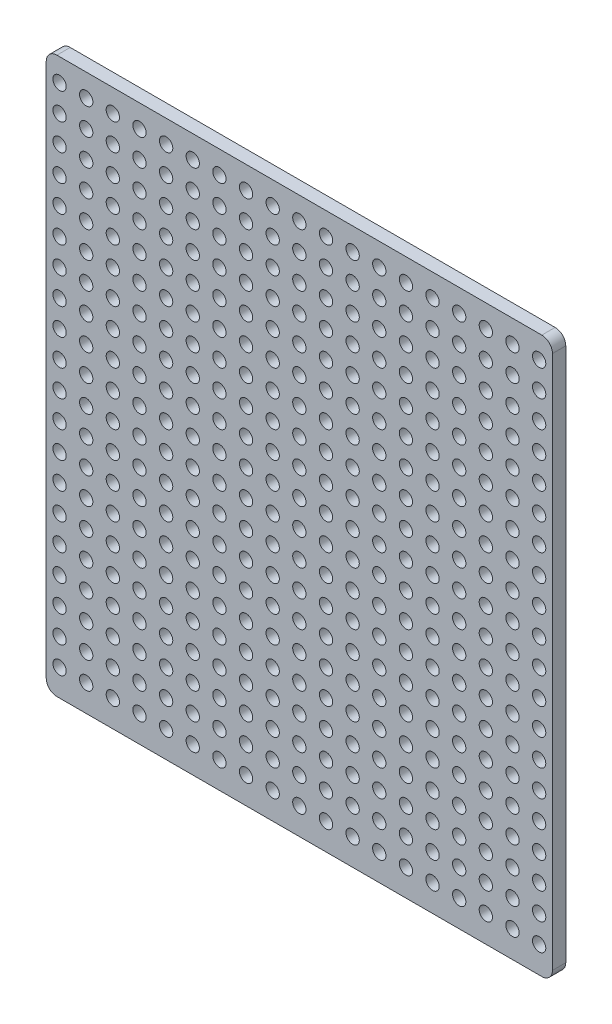
from build123d import *

# Parameters (mm, degrees)
SKETCH1_W           = 190
SKETCH1_H           = 208.5
SKETCH1_R           = 2.5
BOSS_EXTRUDE1_DEPTH = 5
FILLET1_R           = 4


with BuildPart() as part:
    # Sketch1 → Boss-Extrude1 (new body)
    with BuildSketch(Plane.XY):
        with Locations((95, 104.25)):
            Rectangle(SKETCH1_W, SKETCH1_H)
        with Locations((5, 10)):
            Circle(SKETCH1_R, mode=Mode.SUBTRACT)
        with Locations((15, 10)):
            Circle(SKETCH1_R, mode=Mode.SUBTRACT)
        with Locations((25, 10)):
            Circle(SKETCH1_R, mode=Mode.SUBTRACT)
        with Locations((35, 10)):
            Circle(SKETCH1_R, mode=Mode.SUBTRACT)
        with Locations((45, 10)):
            Circle(SKETCH1_R, mode=Mode.SUBTRACT)
        with Locations((55, 10)):
            Circle(SKETCH1_R, mode=Mode.SUBTRACT)
        with Locations((65, 10)):
            Circle(SKETCH1_R, mode=Mode.SUBTRACT)
        with Locations((75, 10)):
            Circle(SKETCH1_R, mode=Mode.SUBTRACT)
        with Locations((85, 10)):
            Circle(SKETCH1_R, mode=Mode.SUBTRACT)
        with Locations((95, 10)):
            Circle(SKETCH1_R, mode=Mode.SUBTRACT)
        with Locations((105, 10)):
            Circle(SKETCH1_R, mode=Mode.SUBTRACT)
        with Locations((115, 10)):
            Circle(SKETCH1_R, mode=Mode.SUBTRACT)
        with Locations((125, 10)):
            Circle(SKETCH1_R, mode=Mode.SUBTRACT)
        with Locations((135, 10)):
            Circle(SKETCH1_R, mode=Mode.SUBTRACT)
        with Locations((145, 10)):
            Circle(SKETCH1_R, mode=Mode.SUBTRACT)
        with Locations((155, 10)):
            Circle(SKETCH1_R, mode=Mode.SUBTRACT)
        with Locations((165, 10)):
            Circle(SKETCH1_R, mode=Mode.SUBTRACT)
        with Locations((175, 10)):
            Circle(SKETCH1_R, mode=Mode.SUBTRACT)
        with Locations((185, 10)):
            Circle(SKETCH1_R, mode=Mode.SUBTRACT)
        with Locations((15, 20)):
            Circle(SKETCH1_R, mode=Mode.SUBTRACT)
        with Locations((25, 20)):
            Circle(SKETCH1_R, mode=Mode.SUBTRACT)
        with Locations((35, 20)):
            Circle(SKETCH1_R, mode=Mode.SUBTRACT)
        with Locations((45, 20)):
            Circle(SKETCH1_R, mode=Mode.SUBTRACT)
        with Locations((55, 20)):
            Circle(SKETCH1_R, mode=Mode.SUBTRACT)
        with Locations((65, 20)):
            Circle(SKETCH1_R, mode=Mode.SUBTRACT)
        with Locations((75, 20)):
            Circle(SKETCH1_R, mode=Mode.SUBTRACT)
        with Locations((85, 20)):
            Circle(SKETCH1_R, mode=Mode.SUBTRACT)
        with Locations((95, 20)):
            Circle(SKETCH1_R, mode=Mode.SUBTRACT)
        with Locations((105, 20)):
            Circle(SKETCH1_R, mode=Mode.SUBTRACT)
        with Locations((115, 20)):
            Circle(SKETCH1_R, mode=Mode.SUBTRACT)
        with Locations((125, 20)):
            Circle(SKETCH1_R, mode=Mode.SUBTRACT)
        with Locations((135, 20)):
            Circle(SKETCH1_R, mode=Mode.SUBTRACT)
        with Locations((145, 20)):
            Circle(SKETCH1_R, mode=Mode.SUBTRACT)
        with Locations((155, 20)):
            Circle(SKETCH1_R, mode=Mode.SUBTRACT)
        with Locations((165, 20)):
            Circle(SKETCH1_R, mode=Mode.SUBTRACT)
        with Locations((175, 20)):
            Circle(SKETCH1_R, mode=Mode.SUBTRACT)
        with Locations((185, 20)):
            Circle(SKETCH1_R, mode=Mode.SUBTRACT)
        with Locations((15, 30)):
            Circle(SKETCH1_R, mode=Mode.SUBTRACT)
        with Locations((25, 30)):
            Circle(SKETCH1_R, mode=Mode.SUBTRACT)
        with Locations((35, 30)):
            Circle(SKETCH1_R, mode=Mode.SUBTRACT)
        with Locations((45, 30)):
            Circle(SKETCH1_R, mode=Mode.SUBTRACT)
        with Locations((55, 30)):
            Circle(SKETCH1_R, mode=Mode.SUBTRACT)
        with Locations((65, 30)):
            Circle(SKETCH1_R, mode=Mode.SUBTRACT)
        with Locations((75, 30)):
            Circle(SKETCH1_R, mode=Mode.SUBTRACT)
        with Locations((85, 30)):
            Circle(SKETCH1_R, mode=Mode.SUBTRACT)
        with Locations((95, 30)):
            Circle(SKETCH1_R, mode=Mode.SUBTRACT)
        with Locations((105, 30)):
            Circle(SKETCH1_R, mode=Mode.SUBTRACT)
        with Locations((115, 30)):
            Circle(SKETCH1_R, mode=Mode.SUBTRACT)
        with Locations((125, 30)):
            Circle(SKETCH1_R, mode=Mode.SUBTRACT)
        with Locations((135, 30)):
            Circle(SKETCH1_R, mode=Mode.SUBTRACT)
        with Locations((145, 30)):
            Circle(SKETCH1_R, mode=Mode.SUBTRACT)
        with Locations((155, 30)):
            Circle(SKETCH1_R, mode=Mode.SUBTRACT)
        with Locations((165, 30)):
            Circle(SKETCH1_R, mode=Mode.SUBTRACT)
        with Locations((175, 30)):
            Circle(SKETCH1_R, mode=Mode.SUBTRACT)
        with Locations((185, 30)):
            Circle(SKETCH1_R, mode=Mode.SUBTRACT)
        with Locations((15, 40)):
            Circle(SKETCH1_R, mode=Mode.SUBTRACT)
        with Locations((25, 40)):
            Circle(SKETCH1_R, mode=Mode.SUBTRACT)
        with Locations((35, 40)):
            Circle(SKETCH1_R, mode=Mode.SUBTRACT)
        with Locations((45, 40)):
            Circle(SKETCH1_R, mode=Mode.SUBTRACT)
        with Locations((55, 40)):
            Circle(SKETCH1_R, mode=Mode.SUBTRACT)
        with Locations((65, 40)):
            Circle(SKETCH1_R, mode=Mode.SUBTRACT)
        with Locations((75, 40)):
            Circle(SKETCH1_R, mode=Mode.SUBTRACT)
        with Locations((85, 40)):
            Circle(SKETCH1_R, mode=Mode.SUBTRACT)
        with Locations((95, 40)):
            Circle(SKETCH1_R, mode=Mode.SUBTRACT)
        with Locations((105, 40)):
            Circle(SKETCH1_R, mode=Mode.SUBTRACT)
        with Locations((115, 40)):
            Circle(SKETCH1_R, mode=Mode.SUBTRACT)
        with Locations((125, 40)):
            Circle(SKETCH1_R, mode=Mode.SUBTRACT)
        with Locations((135, 40)):
            Circle(SKETCH1_R, mode=Mode.SUBTRACT)
        with Locations((145, 40)):
            Circle(SKETCH1_R, mode=Mode.SUBTRACT)
        with Locations((155, 40)):
            Circle(SKETCH1_R, mode=Mode.SUBTRACT)
        with Locations((165, 40)):
            Circle(SKETCH1_R, mode=Mode.SUBTRACT)
        with Locations((175, 40)):
            Circle(SKETCH1_R, mode=Mode.SUBTRACT)
        with Locations((185, 40)):
            Circle(SKETCH1_R, mode=Mode.SUBTRACT)
        with Locations((15, 50)):
            Circle(SKETCH1_R, mode=Mode.SUBTRACT)
        with Locations((25, 50)):
            Circle(SKETCH1_R, mode=Mode.SUBTRACT)
        with Locations((35, 50)):
            Circle(SKETCH1_R, mode=Mode.SUBTRACT)
        with Locations((45, 50)):
            Circle(SKETCH1_R, mode=Mode.SUBTRACT)
        with Locations((55, 50)):
            Circle(SKETCH1_R, mode=Mode.SUBTRACT)
        with Locations((65, 50)):
            Circle(SKETCH1_R, mode=Mode.SUBTRACT)
        with Locations((75, 50)):
            Circle(SKETCH1_R, mode=Mode.SUBTRACT)
        with Locations((85, 50)):
            Circle(SKETCH1_R, mode=Mode.SUBTRACT)
        with Locations((95, 50)):
            Circle(SKETCH1_R, mode=Mode.SUBTRACT)
        with Locations((105, 50)):
            Circle(SKETCH1_R, mode=Mode.SUBTRACT)
        with Locations((115, 50)):
            Circle(SKETCH1_R, mode=Mode.SUBTRACT)
        with Locations((125, 50)):
            Circle(SKETCH1_R, mode=Mode.SUBTRACT)
        with Locations((135, 50)):
            Circle(SKETCH1_R, mode=Mode.SUBTRACT)
        with Locations((145, 50)):
            Circle(SKETCH1_R, mode=Mode.SUBTRACT)
        with Locations((155, 50)):
            Circle(SKETCH1_R, mode=Mode.SUBTRACT)
        with Locations((165, 50)):
            Circle(SKETCH1_R, mode=Mode.SUBTRACT)
        with Locations((175, 50)):
            Circle(SKETCH1_R, mode=Mode.SUBTRACT)
        with Locations((185, 50)):
            Circle(SKETCH1_R, mode=Mode.SUBTRACT)
        with Locations((15, 60)):
            Circle(SKETCH1_R, mode=Mode.SUBTRACT)
        with Locations((25, 60)):
            Circle(SKETCH1_R, mode=Mode.SUBTRACT)
        with Locations((35, 60)):
            Circle(SKETCH1_R, mode=Mode.SUBTRACT)
        with Locations((45, 60)):
            Circle(SKETCH1_R, mode=Mode.SUBTRACT)
        with Locations((55, 60)):
            Circle(SKETCH1_R, mode=Mode.SUBTRACT)
        with Locations((65, 60)):
            Circle(SKETCH1_R, mode=Mode.SUBTRACT)
        with Locations((75, 60)):
            Circle(SKETCH1_R, mode=Mode.SUBTRACT)
        with Locations((85, 60)):
            Circle(SKETCH1_R, mode=Mode.SUBTRACT)
        with Locations((95, 60)):
            Circle(SKETCH1_R, mode=Mode.SUBTRACT)
        with Locations((105, 60)):
            Circle(SKETCH1_R, mode=Mode.SUBTRACT)
        with Locations((115, 60)):
            Circle(SKETCH1_R, mode=Mode.SUBTRACT)
        with Locations((125, 60)):
            Circle(SKETCH1_R, mode=Mode.SUBTRACT)
        with Locations((135, 60)):
            Circle(SKETCH1_R, mode=Mode.SUBTRACT)
        with Locations((145, 60)):
            Circle(SKETCH1_R, mode=Mode.SUBTRACT)
        with Locations((155, 60)):
            Circle(SKETCH1_R, mode=Mode.SUBTRACT)
        with Locations((165, 60)):
            Circle(SKETCH1_R, mode=Mode.SUBTRACT)
        with Locations((175, 60)):
            Circle(SKETCH1_R, mode=Mode.SUBTRACT)
        with Locations((185, 60)):
            Circle(SKETCH1_R, mode=Mode.SUBTRACT)
        with Locations((15, 70)):
            Circle(SKETCH1_R, mode=Mode.SUBTRACT)
        with Locations((25, 70)):
            Circle(SKETCH1_R, mode=Mode.SUBTRACT)
        with Locations((35, 70)):
            Circle(SKETCH1_R, mode=Mode.SUBTRACT)
        with Locations((45, 70)):
            Circle(SKETCH1_R, mode=Mode.SUBTRACT)
        with Locations((55, 70)):
            Circle(SKETCH1_R, mode=Mode.SUBTRACT)
        with Locations((65, 70)):
            Circle(SKETCH1_R, mode=Mode.SUBTRACT)
        with Locations((75, 70)):
            Circle(SKETCH1_R, mode=Mode.SUBTRACT)
        with Locations((85, 70)):
            Circle(SKETCH1_R, mode=Mode.SUBTRACT)
        with Locations((95, 70)):
            Circle(SKETCH1_R, mode=Mode.SUBTRACT)
        with Locations((105, 70)):
            Circle(SKETCH1_R, mode=Mode.SUBTRACT)
        with Locations((115, 70)):
            Circle(SKETCH1_R, mode=Mode.SUBTRACT)
        with Locations((125, 70)):
            Circle(SKETCH1_R, mode=Mode.SUBTRACT)
        with Locations((135, 70)):
            Circle(SKETCH1_R, mode=Mode.SUBTRACT)
        with Locations((145, 70)):
            Circle(SKETCH1_R, mode=Mode.SUBTRACT)
        with Locations((155, 70)):
            Circle(SKETCH1_R, mode=Mode.SUBTRACT)
        with Locations((165, 70)):
            Circle(SKETCH1_R, mode=Mode.SUBTRACT)
        with Locations((175, 70)):
            Circle(SKETCH1_R, mode=Mode.SUBTRACT)
        with Locations((185, 70)):
            Circle(SKETCH1_R, mode=Mode.SUBTRACT)
        with Locations((15, 80)):
            Circle(SKETCH1_R, mode=Mode.SUBTRACT)
        with Locations((25, 80)):
            Circle(SKETCH1_R, mode=Mode.SUBTRACT)
        with Locations((35, 80)):
            Circle(SKETCH1_R, mode=Mode.SUBTRACT)
        with Locations((45, 80)):
            Circle(SKETCH1_R, mode=Mode.SUBTRACT)
        with Locations((55, 80)):
            Circle(SKETCH1_R, mode=Mode.SUBTRACT)
        with Locations((65, 80)):
            Circle(SKETCH1_R, mode=Mode.SUBTRACT)
        with Locations((75, 80)):
            Circle(SKETCH1_R, mode=Mode.SUBTRACT)
        with Locations((85, 80)):
            Circle(SKETCH1_R, mode=Mode.SUBTRACT)
        with Locations((95, 80)):
            Circle(SKETCH1_R, mode=Mode.SUBTRACT)
        with Locations((105, 80)):
            Circle(SKETCH1_R, mode=Mode.SUBTRACT)
        with Locations((115, 80)):
            Circle(SKETCH1_R, mode=Mode.SUBTRACT)
        with Locations((125, 80)):
            Circle(SKETCH1_R, mode=Mode.SUBTRACT)
        with Locations((135, 80)):
            Circle(SKETCH1_R, mode=Mode.SUBTRACT)
        with Locations((145, 80)):
            Circle(SKETCH1_R, mode=Mode.SUBTRACT)
        with Locations((155, 80)):
            Circle(SKETCH1_R, mode=Mode.SUBTRACT)
        with Locations((165, 80)):
            Circle(SKETCH1_R, mode=Mode.SUBTRACT)
        with Locations((175, 80)):
            Circle(SKETCH1_R, mode=Mode.SUBTRACT)
        with Locations((185, 80)):
            Circle(SKETCH1_R, mode=Mode.SUBTRACT)
        with Locations((15, 90)):
            Circle(SKETCH1_R, mode=Mode.SUBTRACT)
        with Locations((25, 90)):
            Circle(SKETCH1_R, mode=Mode.SUBTRACT)
        with Locations((35, 90)):
            Circle(SKETCH1_R, mode=Mode.SUBTRACT)
        with Locations((45, 90)):
            Circle(SKETCH1_R, mode=Mode.SUBTRACT)
        with Locations((55, 90)):
            Circle(SKETCH1_R, mode=Mode.SUBTRACT)
        with Locations((65, 90)):
            Circle(SKETCH1_R, mode=Mode.SUBTRACT)
        with Locations((75, 90)):
            Circle(SKETCH1_R, mode=Mode.SUBTRACT)
        with Locations((85, 90)):
            Circle(SKETCH1_R, mode=Mode.SUBTRACT)
        with Locations((95, 90)):
            Circle(SKETCH1_R, mode=Mode.SUBTRACT)
        with Locations((105, 90)):
            Circle(SKETCH1_R, mode=Mode.SUBTRACT)
        with Locations((115, 90)):
            Circle(SKETCH1_R, mode=Mode.SUBTRACT)
        with Locations((125, 90)):
            Circle(SKETCH1_R, mode=Mode.SUBTRACT)
        with Locations((135, 90)):
            Circle(SKETCH1_R, mode=Mode.SUBTRACT)
        with Locations((145, 90)):
            Circle(SKETCH1_R, mode=Mode.SUBTRACT)
        with Locations((155, 90)):
            Circle(SKETCH1_R, mode=Mode.SUBTRACT)
        with Locations((165, 90)):
            Circle(SKETCH1_R, mode=Mode.SUBTRACT)
        with Locations((175, 90)):
            Circle(SKETCH1_R, mode=Mode.SUBTRACT)
        with Locations((185, 90)):
            Circle(SKETCH1_R, mode=Mode.SUBTRACT)
        with Locations((15, 100)):
            Circle(SKETCH1_R, mode=Mode.SUBTRACT)
        with Locations((25, 100)):
            Circle(SKETCH1_R, mode=Mode.SUBTRACT)
        with Locations((35, 100)):
            Circle(SKETCH1_R, mode=Mode.SUBTRACT)
        with Locations((45, 100)):
            Circle(SKETCH1_R, mode=Mode.SUBTRACT)
        with Locations((55, 100)):
            Circle(SKETCH1_R, mode=Mode.SUBTRACT)
        with Locations((65, 100)):
            Circle(SKETCH1_R, mode=Mode.SUBTRACT)
        with Locations((75, 100)):
            Circle(SKETCH1_R, mode=Mode.SUBTRACT)
        with Locations((85, 100)):
            Circle(SKETCH1_R, mode=Mode.SUBTRACT)
        with Locations((95, 100)):
            Circle(SKETCH1_R, mode=Mode.SUBTRACT)
        with Locations((105, 100)):
            Circle(SKETCH1_R, mode=Mode.SUBTRACT)
        with Locations((115, 100)):
            Circle(SKETCH1_R, mode=Mode.SUBTRACT)
        with Locations((125, 100)):
            Circle(SKETCH1_R, mode=Mode.SUBTRACT)
        with Locations((135, 100)):
            Circle(SKETCH1_R, mode=Mode.SUBTRACT)
        with Locations((145, 100)):
            Circle(SKETCH1_R, mode=Mode.SUBTRACT)
        with Locations((155, 100)):
            Circle(SKETCH1_R, mode=Mode.SUBTRACT)
        with Locations((165, 100)):
            Circle(SKETCH1_R, mode=Mode.SUBTRACT)
        with Locations((175, 100)):
            Circle(SKETCH1_R, mode=Mode.SUBTRACT)
        with Locations((185, 100)):
            Circle(SKETCH1_R, mode=Mode.SUBTRACT)
        with Locations((15, 110)):
            Circle(SKETCH1_R, mode=Mode.SUBTRACT)
        with Locations((25, 110)):
            Circle(SKETCH1_R, mode=Mode.SUBTRACT)
        with Locations((35, 110)):
            Circle(SKETCH1_R, mode=Mode.SUBTRACT)
        with Locations((45, 110)):
            Circle(SKETCH1_R, mode=Mode.SUBTRACT)
        with Locations((55, 110)):
            Circle(SKETCH1_R, mode=Mode.SUBTRACT)
        with Locations((65, 110)):
            Circle(SKETCH1_R, mode=Mode.SUBTRACT)
        with Locations((75, 110)):
            Circle(SKETCH1_R, mode=Mode.SUBTRACT)
        with Locations((85, 110)):
            Circle(SKETCH1_R, mode=Mode.SUBTRACT)
        with Locations((95, 110)):
            Circle(SKETCH1_R, mode=Mode.SUBTRACT)
        with Locations((105, 110)):
            Circle(SKETCH1_R, mode=Mode.SUBTRACT)
        with Locations((115, 110)):
            Circle(SKETCH1_R, mode=Mode.SUBTRACT)
        with Locations((125, 110)):
            Circle(SKETCH1_R, mode=Mode.SUBTRACT)
        with Locations((135, 110)):
            Circle(SKETCH1_R, mode=Mode.SUBTRACT)
        with Locations((145, 110)):
            Circle(SKETCH1_R, mode=Mode.SUBTRACT)
        with Locations((155, 110)):
            Circle(SKETCH1_R, mode=Mode.SUBTRACT)
        with Locations((165, 110)):
            Circle(SKETCH1_R, mode=Mode.SUBTRACT)
        with Locations((175, 110)):
            Circle(SKETCH1_R, mode=Mode.SUBTRACT)
        with Locations((185, 110)):
            Circle(SKETCH1_R, mode=Mode.SUBTRACT)
        with Locations((15, 120)):
            Circle(SKETCH1_R, mode=Mode.SUBTRACT)
        with Locations((25, 120)):
            Circle(SKETCH1_R, mode=Mode.SUBTRACT)
        with Locations((35, 120)):
            Circle(SKETCH1_R, mode=Mode.SUBTRACT)
        with Locations((45, 120)):
            Circle(SKETCH1_R, mode=Mode.SUBTRACT)
        with Locations((55, 120)):
            Circle(SKETCH1_R, mode=Mode.SUBTRACT)
        with Locations((65, 120)):
            Circle(SKETCH1_R, mode=Mode.SUBTRACT)
        with Locations((75, 120)):
            Circle(SKETCH1_R, mode=Mode.SUBTRACT)
        with Locations((85, 120)):
            Circle(SKETCH1_R, mode=Mode.SUBTRACT)
        with Locations((95, 120)):
            Circle(SKETCH1_R, mode=Mode.SUBTRACT)
        with Locations((105, 120)):
            Circle(SKETCH1_R, mode=Mode.SUBTRACT)
        with Locations((115, 120)):
            Circle(SKETCH1_R, mode=Mode.SUBTRACT)
        with Locations((125, 120)):
            Circle(SKETCH1_R, mode=Mode.SUBTRACT)
        with Locations((135, 120)):
            Circle(SKETCH1_R, mode=Mode.SUBTRACT)
        with Locations((145, 120)):
            Circle(SKETCH1_R, mode=Mode.SUBTRACT)
        with Locations((155, 120)):
            Circle(SKETCH1_R, mode=Mode.SUBTRACT)
        with Locations((165, 120)):
            Circle(SKETCH1_R, mode=Mode.SUBTRACT)
        with Locations((175, 120)):
            Circle(SKETCH1_R, mode=Mode.SUBTRACT)
        with Locations((185, 120)):
            Circle(SKETCH1_R, mode=Mode.SUBTRACT)
        with Locations((15, 130)):
            Circle(SKETCH1_R, mode=Mode.SUBTRACT)
        with Locations((25, 130)):
            Circle(SKETCH1_R, mode=Mode.SUBTRACT)
        with Locations((35, 130)):
            Circle(SKETCH1_R, mode=Mode.SUBTRACT)
        with Locations((45, 130)):
            Circle(SKETCH1_R, mode=Mode.SUBTRACT)
        with Locations((55, 130)):
            Circle(SKETCH1_R, mode=Mode.SUBTRACT)
        with Locations((65, 130)):
            Circle(SKETCH1_R, mode=Mode.SUBTRACT)
        with Locations((75, 130)):
            Circle(SKETCH1_R, mode=Mode.SUBTRACT)
        with Locations((85, 130)):
            Circle(SKETCH1_R, mode=Mode.SUBTRACT)
        with Locations((95, 130)):
            Circle(SKETCH1_R, mode=Mode.SUBTRACT)
        with Locations((105, 130)):
            Circle(SKETCH1_R, mode=Mode.SUBTRACT)
        with Locations((115, 130)):
            Circle(SKETCH1_R, mode=Mode.SUBTRACT)
        with Locations((125, 130)):
            Circle(SKETCH1_R, mode=Mode.SUBTRACT)
        with Locations((135, 130)):
            Circle(SKETCH1_R, mode=Mode.SUBTRACT)
        with Locations((145, 130)):
            Circle(SKETCH1_R, mode=Mode.SUBTRACT)
        with Locations((155, 130)):
            Circle(SKETCH1_R, mode=Mode.SUBTRACT)
        with Locations((165, 130)):
            Circle(SKETCH1_R, mode=Mode.SUBTRACT)
        with Locations((175, 130)):
            Circle(SKETCH1_R, mode=Mode.SUBTRACT)
        with Locations((185, 130)):
            Circle(SKETCH1_R, mode=Mode.SUBTRACT)
        with Locations((15, 140)):
            Circle(SKETCH1_R, mode=Mode.SUBTRACT)
        with Locations((25, 140)):
            Circle(SKETCH1_R, mode=Mode.SUBTRACT)
        with Locations((35, 140)):
            Circle(SKETCH1_R, mode=Mode.SUBTRACT)
        with Locations((45, 140)):
            Circle(SKETCH1_R, mode=Mode.SUBTRACT)
        with Locations((55, 140)):
            Circle(SKETCH1_R, mode=Mode.SUBTRACT)
        with Locations((65, 140)):
            Circle(SKETCH1_R, mode=Mode.SUBTRACT)
        with Locations((75, 140)):
            Circle(SKETCH1_R, mode=Mode.SUBTRACT)
        with Locations((85, 140)):
            Circle(SKETCH1_R, mode=Mode.SUBTRACT)
        with Locations((95, 140)):
            Circle(SKETCH1_R, mode=Mode.SUBTRACT)
        with Locations((105, 140)):
            Circle(SKETCH1_R, mode=Mode.SUBTRACT)
        with Locations((115, 140)):
            Circle(SKETCH1_R, mode=Mode.SUBTRACT)
        with Locations((125, 140)):
            Circle(SKETCH1_R, mode=Mode.SUBTRACT)
        with Locations((135, 140)):
            Circle(SKETCH1_R, mode=Mode.SUBTRACT)
        with Locations((145, 140)):
            Circle(SKETCH1_R, mode=Mode.SUBTRACT)
        with Locations((155, 140)):
            Circle(SKETCH1_R, mode=Mode.SUBTRACT)
        with Locations((165, 140)):
            Circle(SKETCH1_R, mode=Mode.SUBTRACT)
        with Locations((175, 140)):
            Circle(SKETCH1_R, mode=Mode.SUBTRACT)
        with Locations((185, 140)):
            Circle(SKETCH1_R, mode=Mode.SUBTRACT)
        with Locations((15, 150)):
            Circle(SKETCH1_R, mode=Mode.SUBTRACT)
        with Locations((25, 150)):
            Circle(SKETCH1_R, mode=Mode.SUBTRACT)
        with Locations((35, 150)):
            Circle(SKETCH1_R, mode=Mode.SUBTRACT)
        with Locations((45, 150)):
            Circle(SKETCH1_R, mode=Mode.SUBTRACT)
        with Locations((55, 150)):
            Circle(SKETCH1_R, mode=Mode.SUBTRACT)
        with Locations((65, 150)):
            Circle(SKETCH1_R, mode=Mode.SUBTRACT)
        with Locations((75, 150)):
            Circle(SKETCH1_R, mode=Mode.SUBTRACT)
        with Locations((85, 150)):
            Circle(SKETCH1_R, mode=Mode.SUBTRACT)
        with Locations((95, 150)):
            Circle(SKETCH1_R, mode=Mode.SUBTRACT)
        with Locations((105, 150)):
            Circle(SKETCH1_R, mode=Mode.SUBTRACT)
        with Locations((115, 150)):
            Circle(SKETCH1_R, mode=Mode.SUBTRACT)
        with Locations((125, 150)):
            Circle(SKETCH1_R, mode=Mode.SUBTRACT)
        with Locations((135, 150)):
            Circle(SKETCH1_R, mode=Mode.SUBTRACT)
        with Locations((145, 150)):
            Circle(SKETCH1_R, mode=Mode.SUBTRACT)
        with Locations((155, 150)):
            Circle(SKETCH1_R, mode=Mode.SUBTRACT)
        with Locations((165, 150)):
            Circle(SKETCH1_R, mode=Mode.SUBTRACT)
        with Locations((175, 150)):
            Circle(SKETCH1_R, mode=Mode.SUBTRACT)
        with Locations((185, 150)):
            Circle(SKETCH1_R, mode=Mode.SUBTRACT)
        with Locations((15, 160)):
            Circle(SKETCH1_R, mode=Mode.SUBTRACT)
        with Locations((25, 160)):
            Circle(SKETCH1_R, mode=Mode.SUBTRACT)
        with Locations((35, 160)):
            Circle(SKETCH1_R, mode=Mode.SUBTRACT)
        with Locations((45, 160)):
            Circle(SKETCH1_R, mode=Mode.SUBTRACT)
        with Locations((55, 160)):
            Circle(SKETCH1_R, mode=Mode.SUBTRACT)
        with Locations((65, 160)):
            Circle(SKETCH1_R, mode=Mode.SUBTRACT)
        with Locations((75, 160)):
            Circle(SKETCH1_R, mode=Mode.SUBTRACT)
        with Locations((85, 160)):
            Circle(SKETCH1_R, mode=Mode.SUBTRACT)
        with Locations((95, 160)):
            Circle(SKETCH1_R, mode=Mode.SUBTRACT)
        with Locations((105, 160)):
            Circle(SKETCH1_R, mode=Mode.SUBTRACT)
        with Locations((115, 160)):
            Circle(SKETCH1_R, mode=Mode.SUBTRACT)
        with Locations((125, 160)):
            Circle(SKETCH1_R, mode=Mode.SUBTRACT)
        with Locations((135, 160)):
            Circle(SKETCH1_R, mode=Mode.SUBTRACT)
        with Locations((145, 160)):
            Circle(SKETCH1_R, mode=Mode.SUBTRACT)
        with Locations((155, 160)):
            Circle(SKETCH1_R, mode=Mode.SUBTRACT)
        with Locations((165, 160)):
            Circle(SKETCH1_R, mode=Mode.SUBTRACT)
        with Locations((175, 160)):
            Circle(SKETCH1_R, mode=Mode.SUBTRACT)
        with Locations((185, 160)):
            Circle(SKETCH1_R, mode=Mode.SUBTRACT)
        with Locations((15, 170)):
            Circle(SKETCH1_R, mode=Mode.SUBTRACT)
        with Locations((25, 170)):
            Circle(SKETCH1_R, mode=Mode.SUBTRACT)
        with Locations((35, 170)):
            Circle(SKETCH1_R, mode=Mode.SUBTRACT)
        with Locations((45, 170)):
            Circle(SKETCH1_R, mode=Mode.SUBTRACT)
        with Locations((55, 170)):
            Circle(SKETCH1_R, mode=Mode.SUBTRACT)
        with Locations((65, 170)):
            Circle(SKETCH1_R, mode=Mode.SUBTRACT)
        with Locations((75, 170)):
            Circle(SKETCH1_R, mode=Mode.SUBTRACT)
        with Locations((85, 170)):
            Circle(SKETCH1_R, mode=Mode.SUBTRACT)
        with Locations((95, 170)):
            Circle(SKETCH1_R, mode=Mode.SUBTRACT)
        with Locations((105, 170)):
            Circle(SKETCH1_R, mode=Mode.SUBTRACT)
        with Locations((115, 170)):
            Circle(SKETCH1_R, mode=Mode.SUBTRACT)
        with Locations((125, 170)):
            Circle(SKETCH1_R, mode=Mode.SUBTRACT)
        with Locations((135, 170)):
            Circle(SKETCH1_R, mode=Mode.SUBTRACT)
        with Locations((145, 170)):
            Circle(SKETCH1_R, mode=Mode.SUBTRACT)
        with Locations((155, 170)):
            Circle(SKETCH1_R, mode=Mode.SUBTRACT)
        with Locations((165, 170)):
            Circle(SKETCH1_R, mode=Mode.SUBTRACT)
        with Locations((175, 170)):
            Circle(SKETCH1_R, mode=Mode.SUBTRACT)
        with Locations((185, 170)):
            Circle(SKETCH1_R, mode=Mode.SUBTRACT)
        with Locations((15, 180)):
            Circle(SKETCH1_R, mode=Mode.SUBTRACT)
        with Locations((25, 180)):
            Circle(SKETCH1_R, mode=Mode.SUBTRACT)
        with Locations((35, 180)):
            Circle(SKETCH1_R, mode=Mode.SUBTRACT)
        with Locations((45, 180)):
            Circle(SKETCH1_R, mode=Mode.SUBTRACT)
        with Locations((55, 180)):
            Circle(SKETCH1_R, mode=Mode.SUBTRACT)
        with Locations((65, 180)):
            Circle(SKETCH1_R, mode=Mode.SUBTRACT)
        with Locations((75, 180)):
            Circle(SKETCH1_R, mode=Mode.SUBTRACT)
        with Locations((85, 180)):
            Circle(SKETCH1_R, mode=Mode.SUBTRACT)
        with Locations((95, 180)):
            Circle(SKETCH1_R, mode=Mode.SUBTRACT)
        with Locations((105, 180)):
            Circle(SKETCH1_R, mode=Mode.SUBTRACT)
        with Locations((115, 180)):
            Circle(SKETCH1_R, mode=Mode.SUBTRACT)
        with Locations((125, 180)):
            Circle(SKETCH1_R, mode=Mode.SUBTRACT)
        with Locations((135, 180)):
            Circle(SKETCH1_R, mode=Mode.SUBTRACT)
        with Locations((145, 180)):
            Circle(SKETCH1_R, mode=Mode.SUBTRACT)
        with Locations((155, 180)):
            Circle(SKETCH1_R, mode=Mode.SUBTRACT)
        with Locations((165, 180)):
            Circle(SKETCH1_R, mode=Mode.SUBTRACT)
        with Locations((175, 180)):
            Circle(SKETCH1_R, mode=Mode.SUBTRACT)
        with Locations((185, 180)):
            Circle(SKETCH1_R, mode=Mode.SUBTRACT)
        with Locations((15, 190)):
            Circle(SKETCH1_R, mode=Mode.SUBTRACT)
        with Locations((25, 190)):
            Circle(SKETCH1_R, mode=Mode.SUBTRACT)
        with Locations((35, 190)):
            Circle(SKETCH1_R, mode=Mode.SUBTRACT)
        with Locations((45, 190)):
            Circle(SKETCH1_R, mode=Mode.SUBTRACT)
        with Locations((55, 190)):
            Circle(SKETCH1_R, mode=Mode.SUBTRACT)
        with Locations((65, 190)):
            Circle(SKETCH1_R, mode=Mode.SUBTRACT)
        with Locations((75, 190)):
            Circle(SKETCH1_R, mode=Mode.SUBTRACT)
        with Locations((85, 190)):
            Circle(SKETCH1_R, mode=Mode.SUBTRACT)
        with Locations((95, 190)):
            Circle(SKETCH1_R, mode=Mode.SUBTRACT)
        with Locations((105, 190)):
            Circle(SKETCH1_R, mode=Mode.SUBTRACT)
        with Locations((115, 190)):
            Circle(SKETCH1_R, mode=Mode.SUBTRACT)
        with Locations((125, 190)):
            Circle(SKETCH1_R, mode=Mode.SUBTRACT)
        with Locations((135, 190)):
            Circle(SKETCH1_R, mode=Mode.SUBTRACT)
        with Locations((145, 190)):
            Circle(SKETCH1_R, mode=Mode.SUBTRACT)
        with Locations((155, 190)):
            Circle(SKETCH1_R, mode=Mode.SUBTRACT)
        with Locations((165, 190)):
            Circle(SKETCH1_R, mode=Mode.SUBTRACT)
        with Locations((175, 190)):
            Circle(SKETCH1_R, mode=Mode.SUBTRACT)
        with Locations((185, 190)):
            Circle(SKETCH1_R, mode=Mode.SUBTRACT)
        with Locations((15, 200)):
            Circle(SKETCH1_R, mode=Mode.SUBTRACT)
        with Locations((25, 200)):
            Circle(SKETCH1_R, mode=Mode.SUBTRACT)
        with Locations((35, 200)):
            Circle(SKETCH1_R, mode=Mode.SUBTRACT)
        with Locations((45, 200)):
            Circle(SKETCH1_R, mode=Mode.SUBTRACT)
        with Locations((55, 200)):
            Circle(SKETCH1_R, mode=Mode.SUBTRACT)
        with Locations((65, 200)):
            Circle(SKETCH1_R, mode=Mode.SUBTRACT)
        with Locations((75, 200)):
            Circle(SKETCH1_R, mode=Mode.SUBTRACT)
        with Locations((85, 200)):
            Circle(SKETCH1_R, mode=Mode.SUBTRACT)
        with Locations((95, 200)):
            Circle(SKETCH1_R, mode=Mode.SUBTRACT)
        with Locations((105, 200)):
            Circle(SKETCH1_R, mode=Mode.SUBTRACT)
        with Locations((115, 200)):
            Circle(SKETCH1_R, mode=Mode.SUBTRACT)
        with Locations((125, 200)):
            Circle(SKETCH1_R, mode=Mode.SUBTRACT)
        with Locations((135, 200)):
            Circle(SKETCH1_R, mode=Mode.SUBTRACT)
        with Locations((145, 200)):
            Circle(SKETCH1_R, mode=Mode.SUBTRACT)
        with Locations((155, 200)):
            Circle(SKETCH1_R, mode=Mode.SUBTRACT)
        with Locations((165, 200)):
            Circle(SKETCH1_R, mode=Mode.SUBTRACT)
        with Locations((175, 200)):
            Circle(SKETCH1_R, mode=Mode.SUBTRACT)
        with Locations((185, 200)):
            Circle(SKETCH1_R, mode=Mode.SUBTRACT)
        with Locations((5, 20)):
            Circle(SKETCH1_R, mode=Mode.SUBTRACT)
        with Locations((5, 30)):
            Circle(SKETCH1_R, mode=Mode.SUBTRACT)
        with Locations((5, 40)):
            Circle(SKETCH1_R, mode=Mode.SUBTRACT)
        with Locations((5, 50)):
            Circle(SKETCH1_R, mode=Mode.SUBTRACT)
        with Locations((5, 60)):
            Circle(SKETCH1_R, mode=Mode.SUBTRACT)
        with Locations((5, 70)):
            Circle(SKETCH1_R, mode=Mode.SUBTRACT)
        with Locations((5, 80)):
            Circle(SKETCH1_R, mode=Mode.SUBTRACT)
        with Locations((5, 90)):
            Circle(SKETCH1_R, mode=Mode.SUBTRACT)
        with Locations((5, 100)):
            Circle(SKETCH1_R, mode=Mode.SUBTRACT)
        with Locations((5, 110)):
            Circle(SKETCH1_R, mode=Mode.SUBTRACT)
        with Locations((5, 120)):
            Circle(SKETCH1_R, mode=Mode.SUBTRACT)
        with Locations((5, 130)):
            Circle(SKETCH1_R, mode=Mode.SUBTRACT)
        with Locations((5, 140)):
            Circle(SKETCH1_R, mode=Mode.SUBTRACT)
        with Locations((5, 150)):
            Circle(SKETCH1_R, mode=Mode.SUBTRACT)
        with Locations((5, 160)):
            Circle(SKETCH1_R, mode=Mode.SUBTRACT)
        with Locations((5, 170)):
            Circle(SKETCH1_R, mode=Mode.SUBTRACT)
        with Locations((5, 180)):
            Circle(SKETCH1_R, mode=Mode.SUBTRACT)
        with Locations((5, 190)):
            Circle(SKETCH1_R, mode=Mode.SUBTRACT)
        with Locations((5, 200)):
            Circle(SKETCH1_R, mode=Mode.SUBTRACT)
    extrude(amount=BOSS_EXTRUDE1_DEPTH)

    # Fillet1
    fillet1_edges = [part.edges().sort_by_distance(p)[0] for p in [
        (190, 0, 2.5),
        (0, 0, 2.5),
        (0, 208.5, 2.5),
        (190, 208.5, 2.5),
    ]]
    fillet(fillet1_edges, radius=FILLET1_R)


solid = part.part
